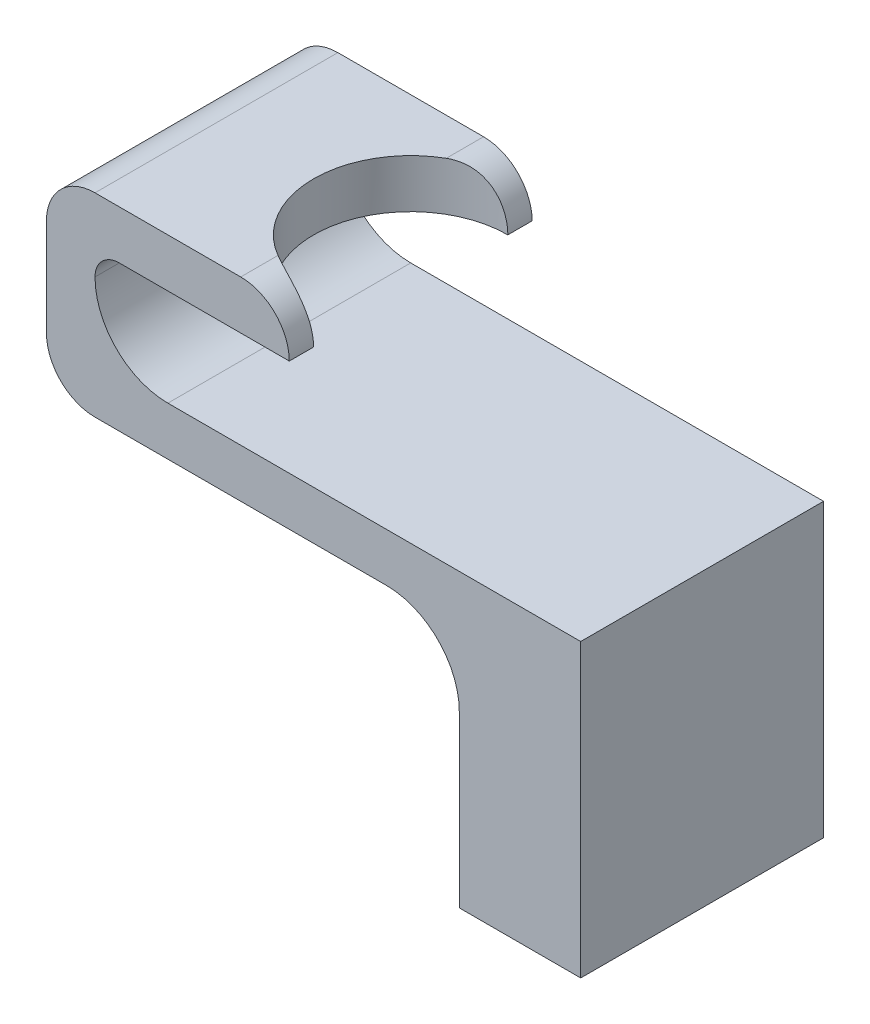
from build123d import *

# Parameters (mm, degrees)
BOSS_EXTRU_1_DEPTH      = 50
ESQUISSE3_R             = 20
ENL_V_MAT_EXTRU_1_DEPTH = 10
CONG_1_R                = 15
CONG_2_R                = 5
CONG_4_R                = 10
CONG_5_R                = 10


with BuildPart() as part:
    # Esquisse2 → Boss.-Extru.1 (new body)
    with BuildSketch(Plane.XY):
        Polygon((-35, 90), (-85, 90), (-85, 50), (0, 50), (0, 0), (25, 0), (25, 60), (-75, 60), (-75, 80), (-35, 80), align=None)
    extrude(amount=BOSS_EXTRU_1_DEPTH)

    # Esquisse3 → Enlèv. mat.-Extru.1 (cut)
    with BuildSketch(Plane(origin=(0, 90, 0), x_dir=(1, 0, 0), z_dir=(0, 1, 0))):
        with Locations((-35, -25)):
            Circle(ESQUISSE3_R)
    extrude(amount=-ENL_V_MAT_EXTRU_1_DEPTH, mode=Mode.SUBTRACT)

    # Congé1
    cong_1_edges = [part.edges().sort_by_distance(p)[0] for p in [
        (0, 50, 25),
        (-75, 60, 25),
    ]]
    fillet(cong_1_edges, radius=CONG_1_R)

    # Congé2
    cong_2_edges = [part.edges().sort_by_distance(p)[0] for p in [
        (-75, 80, 25),
    ]]
    fillet(cong_2_edges, radius=CONG_2_R - 0.0001)  # a hair under: the kernel refuses the full size

    # Congé4
    cong_4_edges = [part.edges().sort_by_distance(p)[0] for p in [
        (-85, 50, 25),
        (-85, 90, 25),
    ]]
    fillet(cong_4_edges, radius=CONG_4_R)

    # Congé5
    cong_5_edges = [part.edges().sort_by_distance(p)[0] for p in [
        (-35, 90, 2.5),
        (-35, 90, 47.5),
    ]]
    fillet(cong_5_edges, radius=CONG_5_R - 0.0001)  # a hair under: the kernel refuses the full size


solid = part.part
